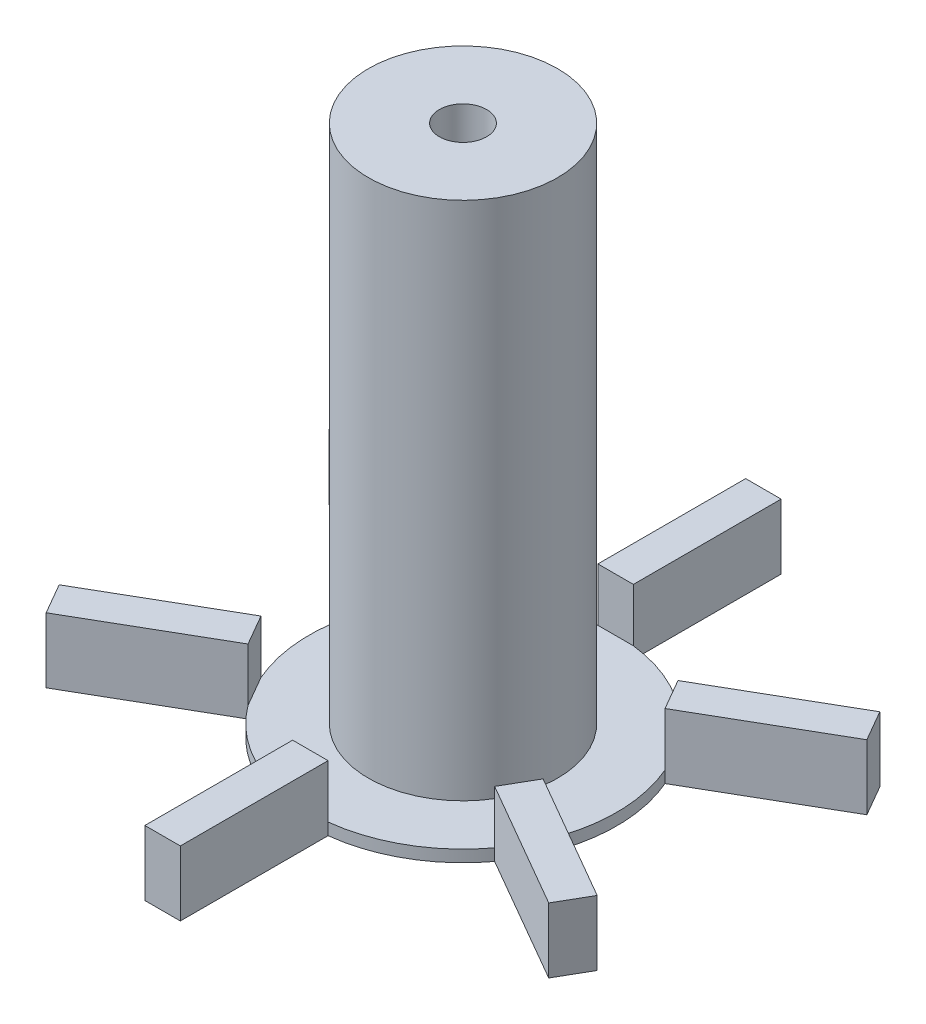
from build123d import *

# Parameters (mm, degrees)
SKETCH1_R             = 8
SKETCH1_R_2           = 2
BOSS_EXTRUDE1_DEPTH   = 45
SKETCH1_3_W           = 3
SKETCH1_3_H           = 12.5
BOSS_EXTRUDE2_DEPTH   = 5.5
BOSS_EXTRUDE2_2_DEPTH = 5.5
BOSS_EXTRUDE2_3_DEPTH = 5.5
BOSS_EXTRUDE2_4_DEPTH = 5.5
BOSS_EXTRUDE2_5_DEPTH = 5.5
BOSS_EXTRUDE2_6_DEPTH = 5.5
SKETCH1_4_R           = 8
BOSS_EXTRUDE3_DEPTH   = 1


with BuildPart() as part:
    # Sketch1 → Boss-Extrude1 (new body)
    with BuildSketch(Plane(origin=(0, 0, 0), x_dir=(1, 0, 0), z_dir=(0, 1, 0))):
        Circle(SKETCH1_R)
        Circle(SKETCH1_R_2, mode=Mode.SUBTRACT)
    extrude(amount=BOSS_EXTRUDE1_DEPTH)

    # Sketch1<4> → Boss-Extrude3 (add)
    with BuildSketch(Plane(origin=(0, 0, 0), x_dir=(1, 0, 0), z_dir=(0, 1, 0))):
        with BuildLine():
            ThreePointArc((-10.433134623, -7.755623891), (-6.5, -11.258330249), (-1.5, -12.91317157))
            Line((-1.5, -12.91317157), (1.5, -12.91317157))
            ThreePointArc((1.5, -12.91317157), (6.5, -11.258330249), (10.433134623, -7.755623891))
            Line((10.433134623, -7.755623891), (11.933134623, -5.157547679))
            ThreePointArc((11.933134623, -5.157547679), (13, 0), (11.933134623, 5.157547679))
            Line((11.933134623, 5.157547679), (10.433134623, 7.755623891))
            ThreePointArc((10.433134623, 7.755623891), (6.5, 11.258330249), (1.5, 12.91317157))
            Line((1.5, 12.91317157), (-1.5, 12.91317157))
            ThreePointArc((-1.5, 12.91317157), (-6.5, 11.258330249), (-10.433134623, 7.755623891))
            Line((-10.433134623, 7.755623891), (-11.933134623, 5.157547679))
            ThreePointArc((-11.933134623, 5.157547679), (-13, 0), (-11.933134623, -5.157547679))
            Line((-11.933134623, -5.157547679), (-10.433134623, -7.755623891))
        make_face()
        Circle(SKETCH1_4_R, mode=Mode.SUBTRACT)
    extrude(amount=BOSS_EXTRUDE3_DEPTH)


with BuildPart() as body_2:
    # Sketch1<3> → Boss-Extrude2 (new body)
    with BuildSketch(Plane(origin=(0, 0, 0), x_dir=(1, 0, 0), z_dir=(0, 1, 0))):
        with Locations((0, -19.16317157)):
            Rectangle(SKETCH1_3_W, SKETCH1_3_H)
    extrude(amount=BOSS_EXTRUDE2_DEPTH)


with BuildPart() as body_3:
    # Sketch1<3> → Boss-Extrude2 2 (new body)
    with BuildSketch(Plane(origin=(0, 0, 0), x_dir=(1, 0, 0), z_dir=(0, 1, 0))):
        Polygon((-21.25845217, -14.005623891), (-10.433134623, -7.755623891), (-11.933134623, -5.157547679), (-22.75845217, -11.407547679), align=None)
    extrude(amount=BOSS_EXTRUDE2_2_DEPTH)


with BuildPart() as body_4:
    # Sketch1<3> → Boss-Extrude2 3 (new body)
    with BuildSketch(Plane(origin=(0, 0, 0), x_dir=(1, 0, 0), z_dir=(0, 1, 0))):
        Polygon((11.933134623, -5.157547679), (10.433134623, -7.755623891), (21.25845217, -14.005623891), (22.75845217, -11.407547679), align=None)
    extrude(amount=BOSS_EXTRUDE2_3_DEPTH)


with BuildPart() as body_5:
    # Sketch1<3> → Boss-Extrude2 4 (new body)
    with BuildSketch(Plane(origin=(0, 0, 0), x_dir=(1, 0, 0), z_dir=(0, 1, 0))):
        Polygon((-22.75845217, 11.407547679), (-11.933134623, 5.157547679), (-10.433134623, 7.755623891), (-21.25845217, 14.005623891), align=None)
    extrude(amount=BOSS_EXTRUDE2_4_DEPTH)


with BuildPart() as body_6:
    # Sketch1<3> → Boss-Extrude2 5 (new body)
    with BuildSketch(Plane(origin=(0, 0, 0), x_dir=(1, 0, 0), z_dir=(0, 1, 0))):
        Polygon((10.433134623, 7.755623891), (11.933134623, 5.157547679), (22.75845217, 11.407547679), (21.25845217, 14.005623891), align=None)
    extrude(amount=BOSS_EXTRUDE2_5_DEPTH)


with BuildPart() as body_7:
    # Sketch1<3> → Boss-Extrude2 6 (new body)
    with BuildSketch(Plane(origin=(0, 0, 0), x_dir=(1, 0, 0), z_dir=(0, 1, 0))):
        with Locations((0, 19.16317157)):
            Rectangle(SKETCH1_3_W, SKETCH1_3_H)
    extrude(amount=BOSS_EXTRUDE2_6_DEPTH)


solid = Compound([part.part, body_2.part, body_3.part, body_4.part, body_5.part, body_6.part, body_7.part])
